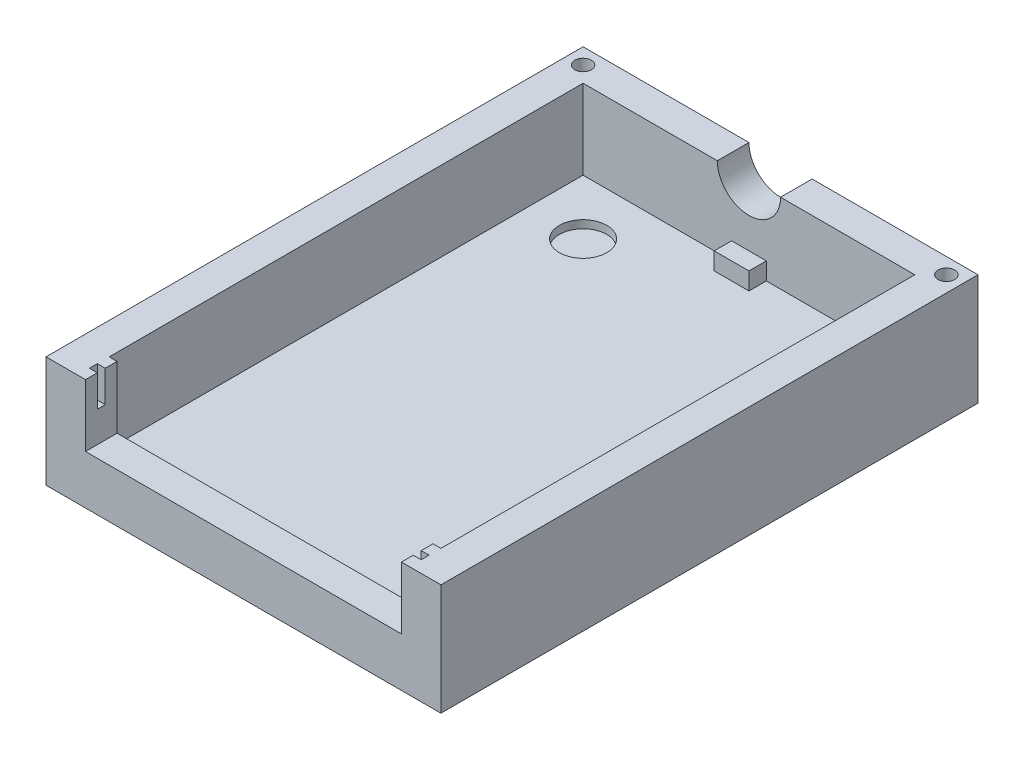
from build123d import *

# Parameters (mm, degrees)
IZIM1_W                     = 25
IZIM1_H                     = 34
Y_KSEKLIK_EKSTR_ZYON1_DEPTH = 7.04
IZIM2_W                     = 21
IZIM2_H                     = 30
KES_EKSTR_ZYON1_DEPTH       = 5.04
IZIM3_W                     = 20
IZIM3_H                     = 3.94
KES_EKSTR_ZYON2_DEPTH       = 36.068669778
FEDER1_START                = -1.1
FEDER1_OUTLINE_W            = 1.1
FEDER1_OUTLINE_H            = 1.1
FEDER1_DEPTH                = 2.2
IZIM7_W                     = 1
IZIM7_H                     = 0.5
KES_EKSTR_ZYON3_DEPTH       = 2
IZIM9_R                     = 2
KES_EKSTR_ZYON4_DEPTH       = 2
IZIM10_R                    = 1.5
KES_EKSTR_ZYON5_DEPTH       = 0.5
IZIM11_R                    = 0.525
KES_EKSTR_ZYON6_DEPTH       = 1.01


# Read off the part's stored shape, not the designer's step: Feder1
with BuildPart() as part:
    # Çizim1 → Yükseklik-Ekstrüzyon1 (new body)
    with BuildSketch(Plane(origin=(0, 7.04, 0), x_dir=(1, 0, 0), z_dir=(0, 1, 0))):
        Rectangle(IZIM1_W, IZIM1_H)
    extrude(amount=-Y_KSEKLIK_EKSTR_ZYON1_DEPTH)

    # Çizim2 → Kes-Ekstrüzyon1 (cut)
    with BuildSketch(Plane(origin=(0, 7.04, 0), x_dir=(-1, 0, 0), z_dir=(0, 1, 0))):
        Rectangle(IZIM2_W, IZIM2_H)
    extrude(amount=-KES_EKSTR_ZYON1_DEPTH, mode=Mode.SUBTRACT)

    # Çizim3 → Kes-Ekstrüzyon2 (cut, through all)
    with BuildSketch(Plane(origin=(0, 0, 15), x_dir=(-1, 0, 0), z_dir=(0, 0, -1))):
        with Locations((0, 5.07)):
            Rectangle(IZIM3_W, IZIM3_H)
    extrude(amount=-KES_EKSTR_ZYON2_DEPTH, mode=Mode.SUBTRACT)

    # Feder1 outline → Feder1 (add)
    with BuildSketch(Plane(origin=(0, 0, 0), x_dir=(0, 0, -1), z_dir=(1, 0, 0)).offset(FEDER1_START)):
        with Locations((14.45, 2.55)):
            Rectangle(FEDER1_OUTLINE_W, FEDER1_OUTLINE_H)
    extrude(amount=FEDER1_DEPTH)

    # Çizim7 → Kes-Ekstrüzyon3 (cut)
    with BuildSketch(Plane(origin=(0, 7.04, 0), x_dir=(1, 0, 0), z_dir=(0, 1, 0))):
        with Locations((-10, -16)):
            Rectangle(IZIM7_W, IZIM7_H)
        with Locations((10, -16)):
            Rectangle(IZIM7_W, IZIM7_H)
    extrude(amount=-KES_EKSTR_ZYON3_DEPTH, mode=Mode.SUBTRACT)

    # Çizim9 → Kes-Ekstrüzyon4 (cut)
    with BuildSketch(Plane(origin=(0, 0, -17), x_dir=(-1, 0, 0), z_dir=(0, 0, -1))):
        with Locations((0, 7.04)):
            Circle(IZIM9_R)
    extrude(amount=-KES_EKSTR_ZYON4_DEPTH, mode=Mode.SUBTRACT)

    # Çizim10 → Kes-Ekstrüzyon5 (cut)
    with BuildSketch(Plane(origin=(0, 2, 0), x_dir=(1, 0, 0), z_dir=(0, 1, 0))):
        with Locations(Location((-7, 11.5, 0), (0, 0, 270))):
            Circle(IZIM10_R)
        with Locations(Location((7, 11.5, 0), (0, 0, 270))):
            Circle(IZIM10_R)
    extrude(amount=-KES_EKSTR_ZYON5_DEPTH, mode=Mode.SUBTRACT)

    # Çizim11 → Kes-Ekstrüzyon6 (cut)
    with BuildSketch(Plane(origin=(0, 7.04, 0), x_dir=(1, 0, 0), z_dir=(0, 1, 0))):
        with Locations(Location((-11.5, 16, 0), (0, 0, 270))):
            Circle(IZIM11_R)
        with Locations(Location((11.5, 16, 0), (0, 0, 270))):
            Circle(IZIM11_R)
    extrude(amount=-KES_EKSTR_ZYON6_DEPTH, mode=Mode.SUBTRACT)


solid = part.part
